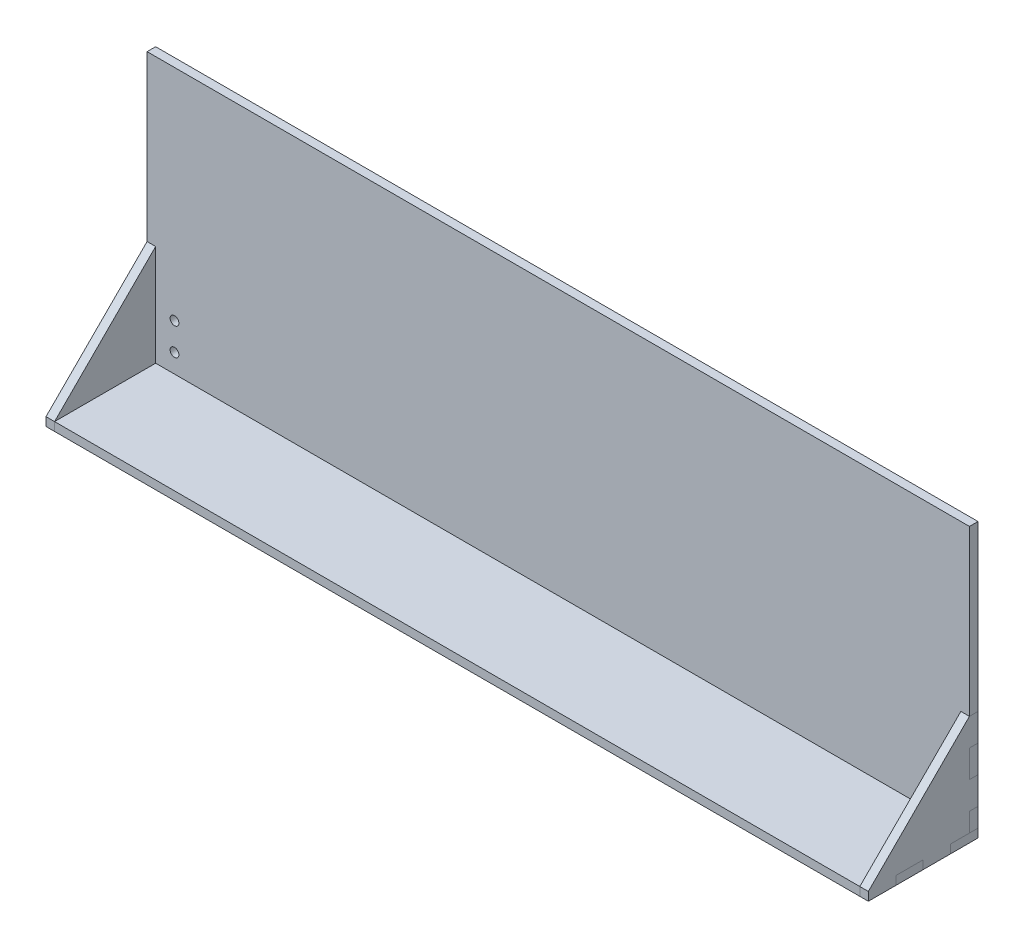
from build123d import *

# Parameters (mm, degrees)
SKETCH1_W               = 300
SKETCH1_H               = 100
BOSS_EXTRUDE1_DEPTH     = 3.12
SKETCH2_W               = 10
SKETCH2_H               = 3.12
CUT_EXTRUDE1_DEPTH      = 3.12
LPATTERN1_COUNT         = 15
LPATTERN1_PITCH         = 20
SKETCH4_W               = 3.12
SKETCH4_H               = 10
CUT_EXTRUDE2_DEPTH      = 3.12
LPATTERN2_COUNT         = 2
LPATTERN2_PITCH         = 20
MIRROR1_COPY_1_SKETCH_W = 3.12
MIRROR1_COPY_1_SKETCH_H = 10
MIRROR1_COPY_1_DEPTH    = 3.12
SKETCH5_W               = 300
SKETCH5_H               = 40
BOSS_EXTRUDE2_DEPTH     = 3.12
SKETCH6_W               = 10
SKETCH6_H               = 3.12
CUT_EXTRUDE3_DEPTH      = 3.12
LPATTERN3_COUNT         = 15
LPATTERN3_PITCH         = 20
SKETCH7_W               = 3.12
SKETCH7_H               = 10
CUT_EXTRUDE4_DEPTH      = 3.12
LPATTERN4_COUNT         = 15
LPATTERN4_PITCH         = 20
BOSS_EXTRUDE3_DEPTH     = 3.12
SKETCH9_R               = 1.6
CUT_EXTRUDE5_DEPTH      = 3.12
MIRROR4_START           = 10
MIRROR4_OUTLINE_W       = 3.12
MIRROR4_OUTLINE_H       = 3.12
MIRROR4_DEPTH           = 10
MIRROR4_START_2         = 30
MIRROR4_2_OUTLINE_W     = 3.12
MIRROR4_2_OUTLINE_H     = 3.12
MIRROR4_2_DEPTH         = 10


# Read off the part's stored shape, not the designer's step: Mirror4
with BuildPart() as part:
    # Sketch1 → Boss-Extrude1 (new body)
    with BuildSketch(Plane.XY):
        with Locations((150, 50)):
            Rectangle(SKETCH1_W, SKETCH1_H)
    extrude(amount=BOSS_EXTRUDE1_DEPTH)

    # Sketch2 → Cut-Extrude1 (cut)
    with BuildSketch(Plane.XY.offset(3.12)):
        with Locations((15, 1.56)):
            Rectangle(SKETCH2_W, SKETCH2_H)
    cut_extrude1 = extrude(amount=-CUT_EXTRUDE1_DEPTH, mode=Mode.SUBTRACT)

    # LPattern1: Cut-Extrude1 ×15
    with Locations(*[(i * LPATTERN1_PITCH, 0, 0) for i in range(1, LPATTERN1_COUNT)]):
        add(cut_extrude1, mode=Mode.SUBTRACT)

    # Sketch4 → Cut-Extrude2 (cut)
    with BuildSketch(Plane.XY.offset(3.12)):
        with Locations((1.56, 15)):
            Rectangle(SKETCH4_W, SKETCH4_H)
    cut_extrude2 = extrude(amount=-CUT_EXTRUDE2_DEPTH, mode=Mode.SUBTRACT)

    # LPattern2: Cut-Extrude2 ×2
    with Locations(*[(0, i * LPATTERN2_PITCH, 0) for i in range(1, LPATTERN2_COUNT)]):
        add(cut_extrude2, mode=Mode.SUBTRACT)

    # Mirror1: Cut-Extrude2 across plane
    add(cut_extrude2.mirror(Plane.ZY.offset(-150)), mode=Mode.SUBTRACT)

    # Mirror1 copy 1 sketch → Mirror1 copy 1 (cut)
    with BuildSketch(Plane(origin=(300, 20, 3.12), x_dir=(-1, 0, 0), z_dir=(0, 0, 1))):
        with Locations((1.56, -15)):
            Rectangle(MIRROR1_COPY_1_SKETCH_W, MIRROR1_COPY_1_SKETCH_H)
    extrude(amount=-MIRROR1_COPY_1_DEPTH, mode=Mode.SUBTRACT)

    # Sketch9 → Cut-Extrude5 (cut)
    with BuildSketch(Plane.XY.offset(3.12)):
        with Locations((10, 20)):
            Circle(SKETCH9_R)
        with Locations((10, 10)):
            Circle(SKETCH9_R)
    cut_extrude5 = extrude(amount=-CUT_EXTRUDE5_DEPTH, mode=Mode.SUBTRACT)

    # Mirror3: Cut-Extrude5 across plane
    add(cut_extrude5.mirror(Plane.ZY.offset(-150)), mode=Mode.SUBTRACT)


with BuildPart() as body_2:
    # Sketch5 → Boss-Extrude2 (new body)
    with BuildSketch(Plane.XZ):
        with Locations((150, 20)):
            Rectangle(SKETCH5_W, SKETCH5_H)
    extrude(amount=-BOSS_EXTRUDE2_DEPTH)

    # Sketch6 → Cut-Extrude3 (cut)
    with BuildSketch(Plane.XZ):
        with Locations((5, 1.56)):
            Rectangle(SKETCH6_W, SKETCH6_H)
    cut_extrude3 = extrude(amount=-CUT_EXTRUDE3_DEPTH, mode=Mode.SUBTRACT)

    # LPattern3: Cut-Extrude3 ×15
    with Locations(*[(i * LPATTERN3_PITCH, 0, 0) for i in range(1, LPATTERN3_COUNT)]):
        add(cut_extrude3, mode=Mode.SUBTRACT)

    # Sketch7 → Cut-Extrude4 (cut)
    with BuildSketch(Plane.XZ):
        with Locations((1.56, 15)):
            Rectangle(SKETCH7_W, SKETCH7_H)
    cut_extrude4 = extrude(amount=-CUT_EXTRUDE4_DEPTH, mode=Mode.SUBTRACT)

    # LPattern4: Cut-Extrude4 ×15
    with Locations(*[(0, 0, i * LPATTERN4_PITCH) for i in range(1, LPATTERN4_COUNT)]):
        add(cut_extrude4, mode=Mode.SUBTRACT)

    # Mirror4 outline → Mirror4 (cut)
    with BuildSketch(Plane.XY.offset(MIRROR4_START)):
        with Locations((298.44, 1.56)):
            Rectangle(MIRROR4_OUTLINE_W, MIRROR4_OUTLINE_H)
    extrude(amount=MIRROR4_DEPTH, mode=Mode.SUBTRACT)

    # Mirror4 2 outline → Mirror4 2 (cut)
    with BuildSketch(Plane.XY.offset(MIRROR4_START_2)):
        with Locations((298.44, 1.56)):
            Rectangle(MIRROR4_2_OUTLINE_W, MIRROR4_2_OUTLINE_H)
    extrude(amount=MIRROR4_2_DEPTH, mode=Mode.SUBTRACT)


with BuildPart() as body_3:
    # Sketch8 → Boss-Extrude3 (new body)
    with BuildSketch(Plane.ZY):
        Polygon((3.12, 40), (0, 40), (0, 30), (3.12, 30), (3.12, 20), (0, 20), (0, 10), (3.12, 10), (3.12, 3.12), (10, 3.12), (10, 0), (20, 0), (20, 3.12), (30, 3.12), (30, 0), (40, 0), (40, 3.12), align=None)
    extrude(amount=-BOSS_EXTRUDE3_DEPTH)


with BuildPart() as body_4:
    # Mirror2: mirrored copy
    add(body_3.part.mirror(Plane.ZY.offset(-150)))


solid = Compound([part.part, body_2.part, body_3.part, body_4.part])
